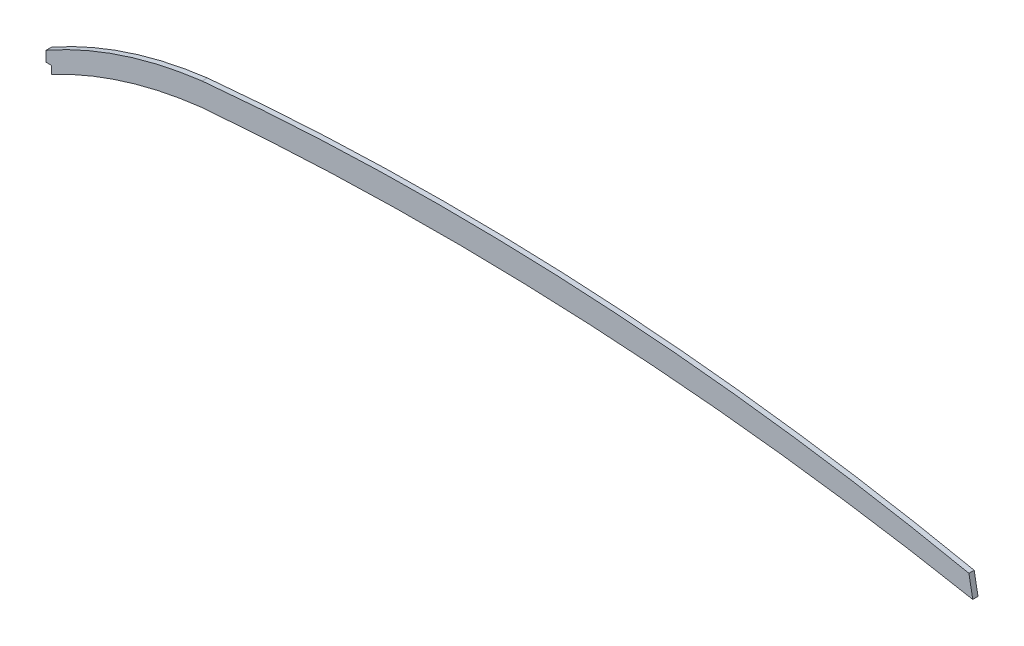
from build123d import *

# Parameters (mm, degrees)
BOSS_EXTRUDE1_DEPTH = 3.175
SKETCH2_W           = 3.3528
SKETCH2_H           = 6.477
CUT_EXTRUDE1_DEPTH  = 577.346072705


with BuildPart() as part:
    # Sketch1 → Boss-Extrude1 (new body)
    with BuildSketch(Plane.XY):
        with BuildLine():
            Line((557.916984218, 99.326538403), (555.638244479, 111.822940833))
            ThreePointArc((555.638244479, 111.822940833), (325.782502236, 142.132503557), (93.98, 137.668))
            ThreePointArc((93.98, 137.668), (45.466310815, 126.795024577), (0, 106.68))
            Line((0, 106.68), (0, 93.98))
            ThreePointArc((0, 93.98), (45.52945751, 113.491169294), (93.98, 123.794671649))
            ThreePointArc((93.98, 123.794671649), (326.784483289, 127.411721364), (557.916984218, 99.326538403))
        make_face()
    extrude(amount=-BOSS_EXTRUDE1_DEPTH)

    # Sketch2 → Cut-Extrude1 (cut, through all)
    with BuildSketch(Plane(origin=(0, 0, -3.175), x_dir=(-1, 0, 0), z_dir=(0, 0, -1))):
        with Locations((-1.6764, 97.2185)):
            Rectangle(SKETCH2_W, SKETCH2_H)
    extrude(amount=-CUT_EXTRUDE1_DEPTH, mode=Mode.SUBTRACT)


solid = part.part
